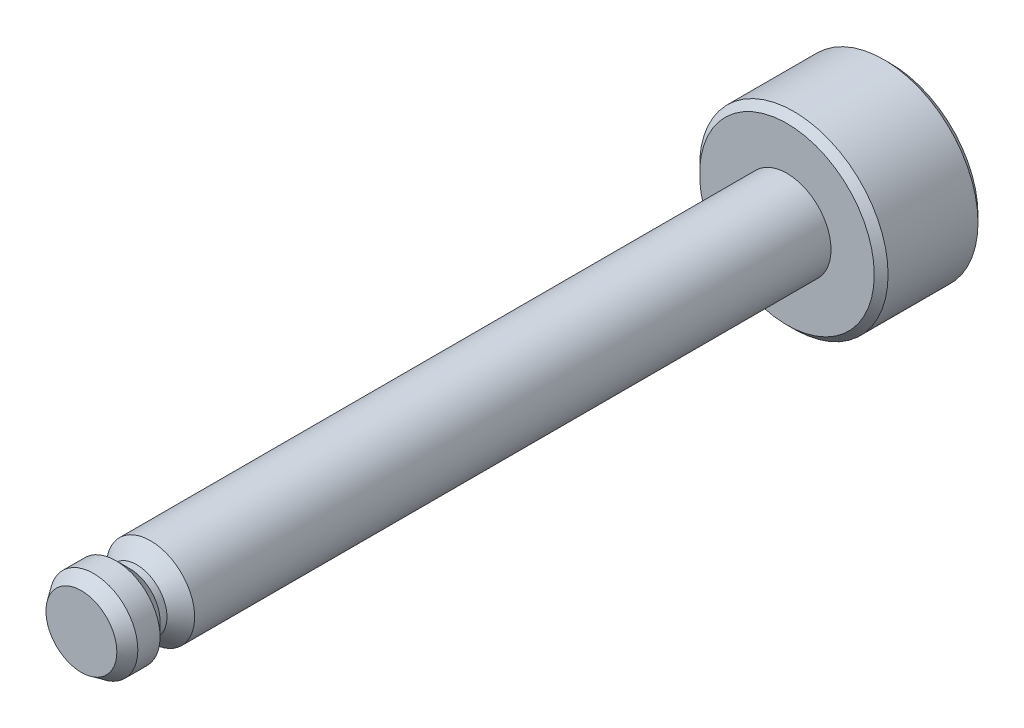
from build123d import *

# Parameters (mm, degrees)
SKETCH2_R      = 1.275
SHAFT_DEPTH    = 20.4
SKETCH5_R      = 2.725
HEAD_DEPTH     = 3
CHAMFER1_SIZE  = 0.25
CHAMFER1_SIZE2 = 0.357037002
DEBURS_SIZE    = 0.2


with BuildPart() as part:
    # Sketch2 → Shaft (new body)
    with BuildSketch(Plane.XY):
        Circle(SKETCH2_R)
    extrude(amount=SHAFT_DEPTH)

    # Sketch5 → Head (add)
    with BuildSketch(Plane.XY):
        Circle(SKETCH5_R)
    extrude(amount=-HEAD_DEPTH)

    # Chamfer1
    chamfer1_edges = [part.edges().sort_by_distance(p)[0] for p in [
        (-1.275, 0, 20.4),
    ]]
    chamfer1_side = [part.faces().sort_by_distance(p)[0] for p in [
        (0, 0, 20.4),
    ]]
    chamfer(chamfer1_edges, length=CHAMFER1_SIZE, length2=CHAMFER1_SIZE2, reference=chamfer1_side[0])

    # Deburs
    deburs_edges = [part.edges().sort_by_distance(p)[0] for p in [
        (-2.725, 0, 0),
        (-2.725, 0, -3),
    ]]
    chamfer(deburs_edges, length=DEBURS_SIZE)

    # Sketch6 → e-Clip Notch Long (revolve, cut)
    with BuildSketch(Plane(origin=(0, 0, 0), x_dir=(0, 0, -1), z_dir=(1, 0, 0))):
        Polygon((-19.4, 1.275), (-18.4, 1.275), (-18.8, 0.875), (-19, 0.875), align=None)
    revolve(axis=Axis((0, 0, 0), (0, 0, 1)), mode=Mode.SUBTRACT)


solid = part.part
